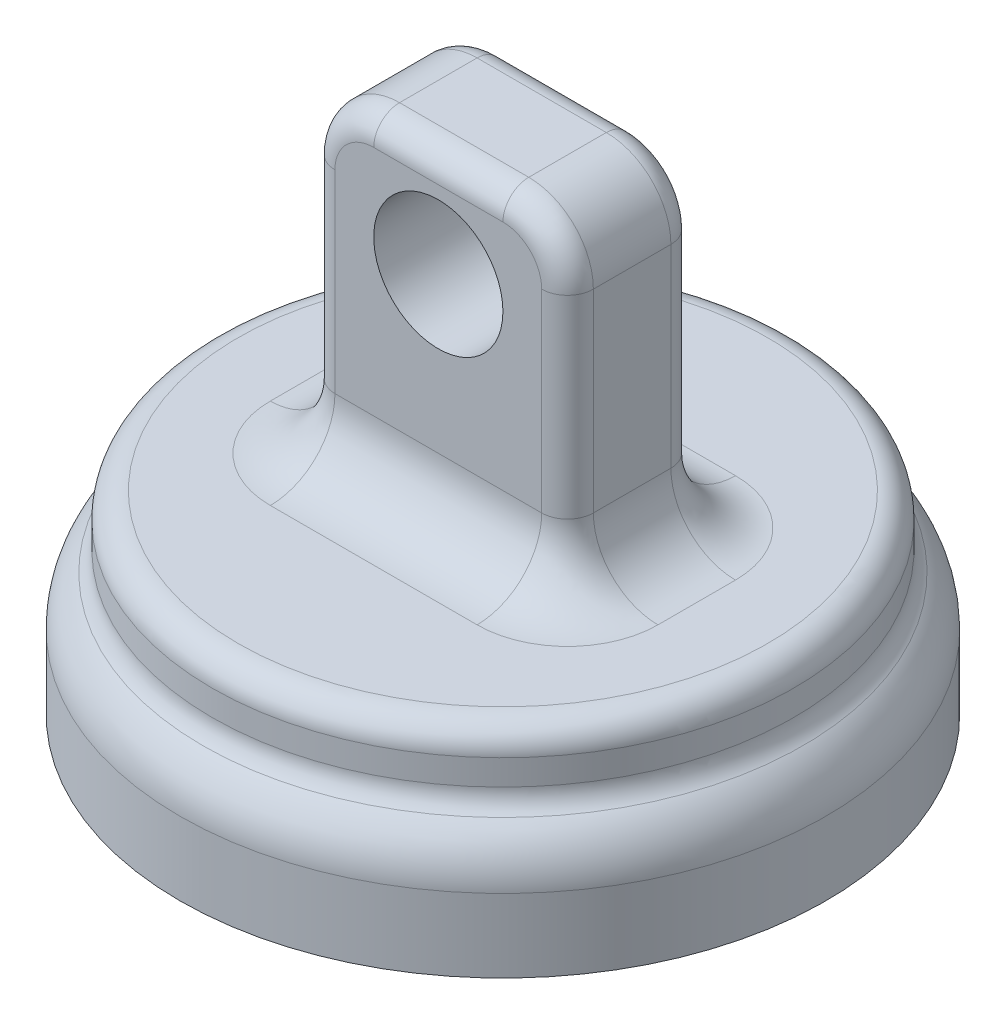
from build123d import *

# Parameters (mm, degrees)
SKETCH1_R           = 25
BOSS_EXTRUDE1_DEPTH = 10
SKETCH2_R           = 22.5
BOSS_EXTRUDE2_DEPTH = 5
FILLET3_R           = 5
FILLET4_R           = 2
FILLET5_R           = 2
SKETCH3_R           = 5
BOSS_EXTRUDE3_DEPTH = 5
FILLET6_R           = 2
FILLET7_R           = 2
FILLET8_R           = 5


with BuildPart() as part:
    # Sketch1 → Boss-Extrude1 (new body)
    with BuildSketch(Plane(origin=(0, 0, 0), x_dir=(1, 0, 0), z_dir=(0, 1, 0))):
        with Locations(Location((0, 0, 0), (0, 0, 270))):
            Circle(SKETCH1_R)
    extrude(amount=BOSS_EXTRUDE1_DEPTH)

    # Sketch2 → Boss-Extrude2 (add)
    with BuildSketch(Plane(origin=(0, 10, 0), x_dir=(1, 0, 0), z_dir=(0, 1, 0))):
        with Locations(Location((0, 0, 0), (0, 0, 270))):
            Circle(SKETCH2_R)
    extrude(amount=BOSS_EXTRUDE2_DEPTH)

    # Fillet3
    # the kernel refuses this fillet: 5 mm, written as the material it takes off along each edge
    with BuildSketch(Plane(origin=(0, 10, 0), x_dir=(0, 0, 1), z_dir=(-1, 0, 0))) as fillet3_piece_1:
        with BuildLine():
            CenterArc((20, -4.330127019), FILLET3_R, 0, 60)
            Line((22.5, 0), (22.55, 0.08660254))
            ThreePointArc((22.55, 0.08660254), (23.75, 0.1), (25, 0.1))
            Line((25, 0.1), (25.1, 0))
            Line((25.1, 0), (25.1, -4.330127019))
            Line((25.1, -4.330127019), (25, -4.330127019))
        make_face()
    revolve(axis=Axis((0, 10, 0), (0, 1, 0)), mode=Mode.SUBTRACT)

    # Fillet4
    fillet4_edges = [part.edges().sort_by_distance(p)[0] for p in [
        (0, 15, -22.5),
    ]]
    fillet(fillet4_edges, radius=FILLET4_R)

    # Fillet5
    fillet5_edges = [part.edges().sort_by_distance(p)[0] for p in [
        (0, 10, -22.5),
    ]]
    fillet(fillet5_edges, radius=FILLET5_R)

    # Sketch3 → Boss-Extrude3 (add, symmetric)
    with BuildSketch(Plane.XY):
        with BuildLine():
            Line((-10, 15), (10, 15))
            Line((10, 15), (10, 35))
            ThreePointArc((10, 35), (8.535533906, 38.535533906), (5, 40))
            Line((5, 40), (-5, 40))
            ThreePointArc((-5, 40), (-8.535533906, 38.535533906), (-10, 35))
            Line((-10, 35), (-10, 15))
        make_face()
        with Locations((0, 32)):
            Circle(SKETCH3_R, mode=Mode.SUBTRACT)
    extrude(amount=BOSS_EXTRUDE3_DEPTH, both=True)

    # Fillet6
    fillet6_edges = [part.edges().sort_by_distance(p)[0] for p in [
        (-10, 25, 5),
        (10, 25, 5),
        (8.535533906, 38.535533906, 5),
        (0, 40, 5),
        (-8.535533906, 38.535533906, 5),
    ]]
    fillet(fillet6_edges, radius=FILLET6_R)

    # Fillet7
    fillet7_edges = [part.edges().sort_by_distance(p)[0] for p in [
        (-10, 25, -5),
        (-8.535533906, 38.535533906, -5),
        (0, 40, -5),
        (8.535533906, 38.535533906, -5),
        (10, 25, -5),
    ]]
    fillet(fillet7_edges, radius=FILLET7_R)

    # Fillet8
    fillet8_edges = [part.edges().sort_by_distance(p)[0] for p in [
        (0, 15, 5),
        (9.414213562, 15, 4.414213562),
        (-9.414213562, 15, 4.414213562),
        (10, 15, 0),
        (0, 15, -5),
        (-10, 15, 0),
        (9.414213562, 15, -4.414213562),
        (-9.414213562, 15, -4.414213562),
    ]]
    fillet(fillet8_edges, radius=FILLET8_R)


solid = part.part
